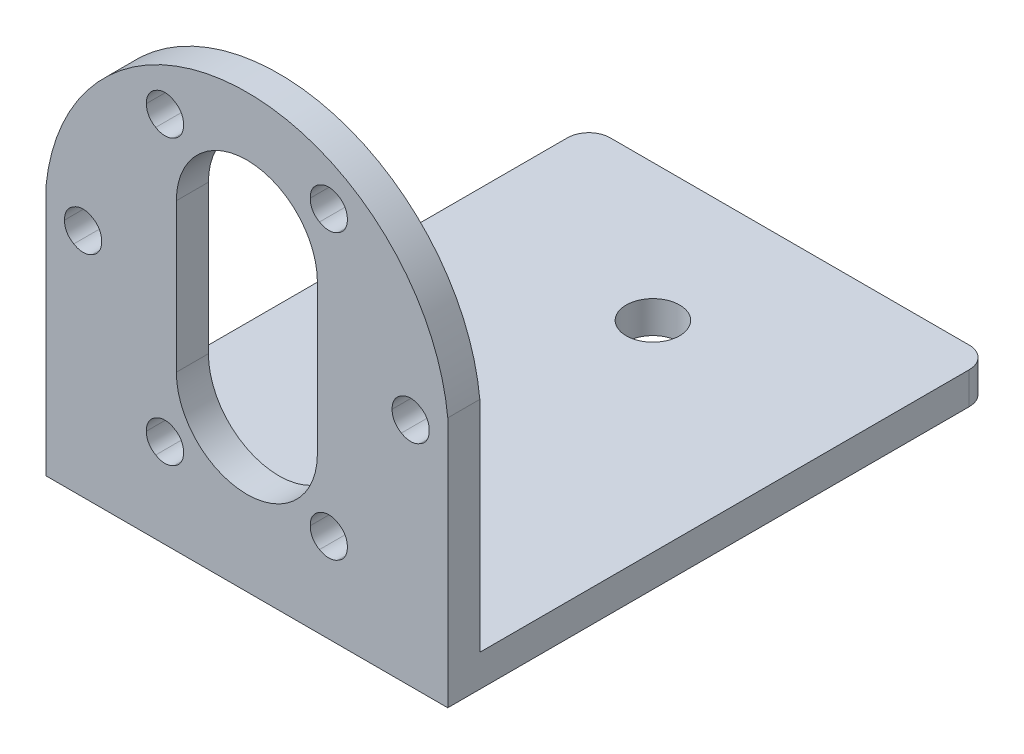
from build123d import *

# Parameters (mm, degrees)
BOSS_EXTRUDE1_DEPTH        = 3
BOSS_EXTRUDE2_DEPTH        = 1.5
BOSS_EXTRUDE2_DEPTH_BACK   = 1.5
SKETCH2_W                  = 37.6
SKETCH2_H                  = 50.8
FILLET2_R                  = 2
CUT_EXTRUDE2_REACH         = 68.746
SKETCH4_R                  = 1.6
CIRPATTERN1_COUNT          = 6
SZKIC1_R                   = 2.5
WYTNIJ_WYCI_GNI_CIE1_DEPTH = 10


with BuildPart() as part:
    # Sketch1 → Boss-Extrude1 (new body)
    with BuildSketch(Plane.XY):
        with BuildLine():
            Line((-18.8, 0), (18.8, 0))
            Line((18.8, 0), (18.8, 22))
            ThreePointArc((18.8, 22), (0, 39), (-18.8, 22))
            Line((-18.8, 22), (-18.8, 0))
        make_face()
        with BuildLine():
            Line((-6.6, 12.999434154), (-6.6, 26.899434154))
            ThreePointArc((-6.6, 26.899434154), (0, 33.5), (6.6, 26.899434154))
            Line((6.6, 26.899434154), (6.6, 12.999434154))
            ThreePointArc((6.6, 12.999434154), (0, 6.399999946), (-6.6, 12.999434154))
        make_face(mode=Mode.SUBTRACT)
    extrude(amount=BOSS_EXTRUDE1_DEPTH)

    # Sketch2 → Boss-Extrude2 (add, two sides: drawn at the far end of the back side and taken through both)
    with BuildSketch(Plane.XZ.offset(-BOSS_EXTRUDE2_DEPTH_BACK)):
        with Locations((0, -22.4)):
            Rectangle(SKETCH2_W, SKETCH2_H)
    extrude(amount=BOSS_EXTRUDE2_DEPTH + BOSS_EXTRUDE2_DEPTH_BACK)

    # Fillet2
    fillet2_edges = [part.edges().sort_by_distance(p)[0] for p in [
        (-18.8, 0, -47.8),
        (18.8, 0, -47.8),
    ]]
    fillet(fillet2_edges, radius=FILLET2_R)

    # Sketch4 → Cut-Extrude2 (cut, up to next)
    with BuildSketch(Plane.XY.offset(3), mode=Mode.PRIVATE) as cut_extrude2_sk1:
        with Locations((7.664771385, 33.22577344)):
            Circle(SKETCH4_R)
    cut_extrude2_tool1 = extrude(cut_extrude2_sk1.sketch, amount=-CUT_EXTRUDE2_REACH, mode=Mode.PRIVATE) & part.part
    # Sketch4 → Cut-Extrude2 (cut, up to next)
    with BuildSketch(Plane.XY.offset(3), mode=Mode.PRIVATE) as cut_extrude2_sk2:
        with Locations((15.32954277, 19.949999973)):
            Circle(SKETCH4_R)
    cut_extrude2_tool2 = extrude(cut_extrude2_sk2.sketch, amount=-CUT_EXTRUDE2_REACH, mode=Mode.PRIVATE) & part.part
    # Sketch4 → Cut-Extrude2 (cut, up to next)
    with BuildSketch(Plane.XY.offset(3), mode=Mode.PRIVATE) as cut_extrude2_sk3:
        with Locations((7.664771385, 6.674226506)):
            Circle(SKETCH4_R)
    cut_extrude2_tool3 = extrude(cut_extrude2_sk3.sketch, amount=-CUT_EXTRUDE2_REACH, mode=Mode.PRIVATE) & part.part
    # Sketch4 → Cut-Extrude2 (cut, up to next)
    with BuildSketch(Plane.XY.offset(3), mode=Mode.PRIVATE) as cut_extrude2_sk4:
        with Locations((-7.664771385, 6.674226506)):
            Circle(SKETCH4_R)
    cut_extrude2_tool4 = extrude(cut_extrude2_sk4.sketch, amount=-CUT_EXTRUDE2_REACH, mode=Mode.PRIVATE) & part.part
    # Sketch4 → Cut-Extrude2 (cut, up to next)
    with BuildSketch(Plane.XY.offset(3), mode=Mode.PRIVATE) as cut_extrude2_sk5:
        with Locations((-15.32954277, 19.949999973)):
            Circle(SKETCH4_R)
    cut_extrude2_tool5 = extrude(cut_extrude2_sk5.sketch, amount=-CUT_EXTRUDE2_REACH, mode=Mode.PRIVATE) & part.part
    # Sketch4 → Cut-Extrude2 (cut, up to next)
    with BuildSketch(Plane.XY.offset(3), mode=Mode.PRIVATE) as cut_extrude2_sk6:
        with Locations((-7.664771385, 33.22577344)):
            Circle(SKETCH4_R)
    cut_extrude2_tool6 = extrude(cut_extrude2_sk6.sketch, amount=-CUT_EXTRUDE2_REACH, mode=Mode.PRIVATE) & part.part
    cut_extrude2_1 = cut_extrude2_tool1.solids().sort_by_distance((7.664771, 33.225773, 3))[0]
    add(cut_extrude2_1, mode=Mode.SUBTRACT)
    cut_extrude2_2 = cut_extrude2_tool2.solids().sort_by_distance((15.329543, 19.95, 3))[0]
    add(cut_extrude2_2, mode=Mode.SUBTRACT)
    cut_extrude2_3 = cut_extrude2_tool3.solids().sort_by_distance((7.664771, 6.674227, 3))[0]
    add(cut_extrude2_3, mode=Mode.SUBTRACT)
    cut_extrude2_4 = cut_extrude2_tool4.solids().sort_by_distance((-7.664771, 6.674227, 3))[0]
    add(cut_extrude2_4, mode=Mode.SUBTRACT)
    cut_extrude2_5 = cut_extrude2_tool5.solids().sort_by_distance((-15.329543, 19.95, 3))[0]
    add(cut_extrude2_5, mode=Mode.SUBTRACT)
    cut_extrude2_6 = cut_extrude2_tool6.solids().sort_by_distance((-7.664771, 33.225773, 3))[0]
    add(cut_extrude2_6, mode=Mode.SUBTRACT)
    cut_extrude2 = cut_extrude2_1 + cut_extrude2_2 + cut_extrude2_3 + cut_extrude2_4 + cut_extrude2_5 + cut_extrude2_6  # Cut-Extrude2 as one shape, for the pattern or mirror that repeats it

    # CirPattern1: Cut-Extrude2 ×6 about axis
    cirpattern1_axis = Axis((0, 20.104705882, 3), (0, 0, -1))
    for i in range(1, CIRPATTERN1_COUNT):
        add(cut_extrude2.rotate(cirpattern1_axis, i * 360 / CIRPATTERN1_COUNT), mode=Mode.SUBTRACT)

    # Szkic1 → Wytnij-wyciągnięcie1 (cut)
    with BuildSketch(Plane(origin=(0, 1.5, 0), x_dir=(1, 0, 0), z_dir=(0, 1, 0))):
        with Locations((0, 15)):
            Circle(SZKIC1_R)
        with Locations((0, 35)):
            Circle(SZKIC1_R)
    extrude(amount=-WYTNIJ_WYCI_GNI_CIE1_DEPTH, mode=Mode.SUBTRACT)


solid = part.part
